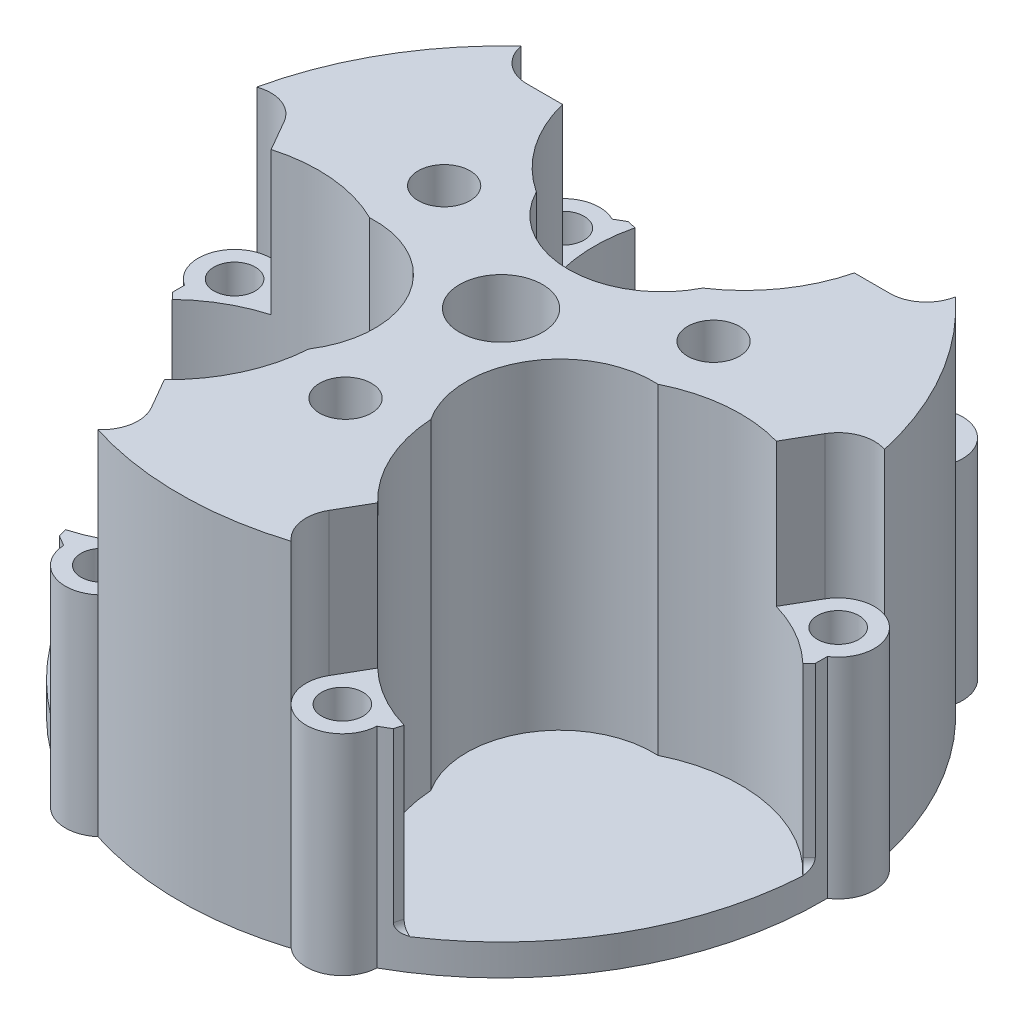
from build123d import *
from build123d.topology import SkipClean

# Parameters (mm, degrees)
BOSS_EXTRUDE1_DEPTH = 19
CUT_EXTRUDE1_START  = -1.8
SKETCH3_R           = 2
CUT_EXTRUDE1_DEPTH  = 1.8
BOSS_EXTRUDE2_START = 3
BOSS_EXTRUDE2_DEPTH = 3
SKETCH5_R           = 2
SKETCH5_R_2         = 4
SKETCH5_R_3         = 2.5
CUT_EXTRUDE2_DEPTH  = 51.078579515
CUT_EXTRUDE3_START  = -19
CUT_EXTRUDE3_DEPTH  = 19
SKETCH9_R           = 2.5
SKETCH9_R_2         = 4
BOSS_EXTRUDE3_DEPTH = 12
CUT_EXTRUDE4_START  = -31
CUT_EXTRUDE4_DEPTH  = 31
FILLET1_R           = 1


with BuildPart() as part:
    # Sketch1 → Boss-Extrude1 (new body)
    with BuildSketch(Plane(origin=(0, 0, 0), x_dir=(1, 0, 0), z_dir=(0, 1, 0))):
        with BuildLine():
            ThreePointArc((13.871296136, 27.723404255), (0, 9), (-13.871296136, 27.723404255))
            ThreePointArc((-13.871296136, 27.723404255), (-14.895543516, 27.186812674), (-15.899067131, 26.612396817))
            ThreePointArc((-15.899067131, 26.612396817), (-19.590431511, 26.307150886), (-20.940624191, 22.858045815))
            ThreePointArc((-20.940624191, 22.858045815), (-26.846787517, 15.5), (-30.265960452, 6.706089613))
            ThreePointArc((-30.265960452, 6.706089613), (-32.577876724, 3.812235917), (-30.996545265, 0.462797623))
            ThreePointArc((-30.996545265, 0.462797623), (-30.992242181, -0.693487249), (-30.944820433, -1.84880729))
            ThreePointArc((-30.944820433, -1.84880729), (-7.794228634, -4.5), (-17.073524296, -25.874596965))
            ThreePointArc((-17.073524296, -25.874596965), (-16.096698665, -26.493325425), (-15.097478134, -27.075194441))
            ThreePointArc((-15.097478134, -27.075194441), (-12.987445213, -30.119386803), (-9.325336261, -29.564135428))
            ThreePointArc((-9.325336261, -29.564135428), (0, -31), (9.325336261, -29.564135428))
            ThreePointArc((9.325336261, -29.564135428), (12.987445213, -30.119386803), (15.097478134, -27.075194441))
            ThreePointArc((15.097478134, -27.075194441), (16.096698665, -26.493325425), (17.073524296, -25.874596965))
            ThreePointArc((17.073524296, -25.874596965), (7.794228634, -4.5), (30.944820433, -1.84880729))
            ThreePointArc((30.944820433, -1.84880729), (30.992242181, -0.693487249), (30.996545265, 0.462797623))
            ThreePointArc((30.996545265, 0.462797623), (32.577876724, 3.812235917), (30.265960452, 6.706089613))
            ThreePointArc((30.265960452, 6.706089613), (26.846787517, 15.5), (20.940624191, 22.858045815))
            ThreePointArc((20.940624191, 22.858045815), (19.590431511, 26.307150886), (15.899067131, 26.612396817))
            ThreePointArc((15.899067131, 26.612396817), (14.895543516, 27.186812674), (13.871296136, 27.723404255))
        make_face()
    extrude(amount=BOSS_EXTRUDE1_DEPTH)

    # Sketch3 → Cut-Extrude1 (cut)
    # profile 1 of 6: a face of its own
    with BuildSketch(Plane(origin=(0, 19, 0), x_dir=(1, 0, 0), z_dir=(0, 1, 0)).offset(CUT_EXTRUDE1_START)):
        with BuildLine():
            ThreePointArc((-15.899067131, 26.612396817), (-20.901719334, 24.323593085), (-17.5, 20))
            Line((-17.5, 20), (-14.071247279, 20))
            ThreePointArc((-14.071247279, 20), (-14.495143202, 23.875264632), (-13.871296136, 27.723404255))
            ThreePointArc((-13.871296136, 27.723404255), (-14.895543516, 27.186812674), (-15.899067131, 26.612396817))
        make_face()
        with Locations(Location((-17.5, 23.5, 0), (0, 0, 270))):
            Circle(SKETCH3_R, mode=Mode.SUBTRACT)
    # profile 2 of 6: a face of its own
    with BuildSketch(Plane(origin=(0, 19, 0), x_dir=(1, 0, 0), z_dir=(0, 1, 0)).offset(CUT_EXTRUDE1_START)):
        with BuildLine():
            ThreePointArc((13.871296136, 27.723404255), (14.495143202, 23.875264632), (14.071247279, 20))
            Line((14.071247279, 20), (17.5, 20))
            ThreePointArc((17.5, 20), (20.901719334, 24.323593085), (15.899067131, 26.612396817))
            ThreePointArc((15.899067131, 26.612396817), (14.895543516, 27.186812674), (13.871296136, 27.723404255))
        make_face()
        with Locations(Location((17.5, 23.5, 0), (0, 0, 270))):
            Circle(SKETCH3_R, mode=Mode.SUBTRACT)
    # profile 3 of 6: a face of its own
    with BuildSketch(Plane(origin=(0, 19, 0), x_dir=(1, 0, 0), z_dir=(0, 1, 0)).offset(CUT_EXTRUDE1_START)):
        with BuildLine():
            ThreePointArc((-26.070508076, 5.155444566), (-31.51570919, 5.939623384), (-30.996545265, 0.462797623))
            ThreePointArc((-30.996545265, 0.462797623), (-30.992242181, -0.693487249), (-30.944820433, -1.84880729))
            ThreePointArc((-30.944820433, -1.84880729), (-27.924157295, 0.615529929), (-24.356131715, 2.186057607))
            Line((-24.356131715, 2.186057607), (-26.070508076, 5.155444566))
        make_face()
        with Locations(Location((-29.101596989, 3.405444566, 0), (0, 0, 270))):
            Circle(SKETCH3_R, mode=Mode.SUBTRACT)
    # profile 4 of 6: a face of its own
    with BuildSketch(Plane(origin=(0, 19, 0), x_dir=(1, 0, 0), z_dir=(0, 1, 0)).offset(CUT_EXTRUDE1_START)):
        with BuildLine():
            ThreePointArc((30.996545265, 0.462797623), (31.51570919, 5.939623384), (26.070508076, 5.155444566))
            Line((26.070508076, 5.155444566), (24.356131715, 2.186057607))
            ThreePointArc((24.356131715, 2.186057607), (27.924157295, 0.615529929), (30.944820433, -1.84880729))
            ThreePointArc((30.944820433, -1.84880729), (30.992242181, -0.693487249), (30.996545265, 0.462797623))
        make_face()
        with Locations(Location((29.101596989, 3.405444566, 0), (0, 0, 270))):
            Circle(SKETCH3_R, mode=Mode.SUBTRACT)
    # profile 5 of 6: a face of its own
    with BuildSketch(Plane(origin=(0, 19, 0), x_dir=(1, 0, 0), z_dir=(0, 1, 0)).offset(CUT_EXTRUDE1_START)):
        with BuildLine():
            Line((-8.570508076, -25.155444566), (-10.284884436, -22.186057607))
            ThreePointArc((-10.284884436, -22.186057607), (-13.429014092, -24.490794561), (-17.073524296, -25.874596965))
            ThreePointArc((-17.073524296, -25.874596965), (-16.096698665, -26.493325425), (-15.097478134, -27.075194441))
            ThreePointArc((-15.097478134, -27.075194441), (-10.613989856, -30.263216469), (-8.570508076, -25.155444566))
        make_face()
        with Locations(Location((-11.601596989, -26.905444566, 0), (0, 0, 270))):
            Circle(SKETCH3_R, mode=Mode.SUBTRACT)
    # profile 6 of 6: a face of its own
    with BuildSketch(Plane(origin=(0, 19, 0), x_dir=(1, 0, 0), z_dir=(0, 1, 0)).offset(CUT_EXTRUDE1_START)):
        with BuildLine():
            ThreePointArc((17.073524296, -25.874596965), (13.429014092, -24.490794561), (10.284884436, -22.186057607))
            Line((10.284884436, -22.186057607), (8.570508076, -25.155444566))
            ThreePointArc((8.570508076, -25.155444566), (10.613989856, -30.263216469), (15.097478134, -27.075194441))
            ThreePointArc((15.097478134, -27.075194441), (16.096698665, -26.493325425), (17.073524296, -25.874596965))
        make_face()
        with Locations(Location((11.601596989, -26.905444566, 0), (0, 0, 270))):
            Circle(SKETCH3_R, mode=Mode.SUBTRACT)
    extrude(amount=CUT_EXTRUDE1_DEPTH, mode=Mode.SUBTRACT)

    # Sketch8 → Boss-Extrude2 (add)
    with SkipClean():  # the faces are left unmerged after this step: merging them gives an invalid solid
        with BuildSketch(Plane.XZ.offset(BOSS_EXTRUDE2_START)):
            with BuildLine():
                ThreePointArc((-15.097478134, 27.075194441), (-26.846787517, 15.5), (-30.996545265, -0.462797623))
                ThreePointArc((-30.996545265, -0.462797623), (-32.577876724, -3.812235917), (-30.265960452, -6.706089613))
                ThreePointArc((-30.265960452, -6.706089613), (-26.846787517, -15.5), (-20.940624191, -22.858045815))
                ThreePointArc((-20.940624191, -22.858045815), (-19.590431511, -26.307150886), (-15.899067131, -26.612396817))
                ThreePointArc((-15.899067131, -26.612396817), (0, -31), (15.899067131, -26.612396817))
                ThreePointArc((15.899067131, -26.612396817), (19.590431511, -26.307150886), (20.940624191, -22.858045815))
                ThreePointArc((20.940624191, -22.858045815), (26.846787517, -15.5), (30.265960452, -6.706089613))
                ThreePointArc((30.265960452, -6.706089613), (32.577876724, -3.812235917), (30.996545265, -0.462797623))
                ThreePointArc((30.996545265, -0.462797623), (26.846787517, 15.5), (15.097478134, 27.075194441))
                ThreePointArc((15.097478134, 27.075194441), (12.987445213, 30.119386803), (9.325336261, 29.564135428))
                ThreePointArc((9.325336261, 29.564135428), (0, 31), (-9.325336261, 29.564135428))
                ThreePointArc((-9.325336261, 29.564135428), (-12.987445213, 30.119386803), (-15.097478134, 27.075194441))
            make_face()
        extrude(amount=-BOSS_EXTRUDE2_DEPTH)

    # Sketch5 → Cut-Extrude2 (cut, through all)
    with SkipClean():  # the faces are left unmerged after this step: merging them gives an invalid solid
        with BuildSketch(Plane(origin=(0, 19, 0), x_dir=(1, 0, 0), z_dir=(0, 1, 0))):
            with Locations(Location((17.5, 23.5, 0), (0, 0, 270))):
                Circle(SKETCH5_R)
            with Locations(Location((-17.5, 23.5, 0), (0, 0, 270))):
                Circle(SKETCH5_R)
            with Locations(Location((0, 0, 0), (0, 0, 270))):
                Circle(SKETCH5_R_2)
            with Locations(Location((-12.990381057, 7.5, 0), (0, 0, 270))):
                Circle(SKETCH5_R_3)
            with Locations(Location((12.990381057, 7.5, 0), (0, 0, 270))):
                Circle(SKETCH5_R_3)
            with Locations(Location((0, -15, 0), (0, 0, 270))):
                Circle(SKETCH5_R_3)
            with Locations(Location((-29.101596989, 3.405444566, 0), (0, 0, 270))):
                Circle(SKETCH5_R)
            with Locations(Location((11.601596989, -26.905444566, 0), (0, 0, 270))):
                Circle(SKETCH5_R)
            with Locations(Location((29.101596989, 3.405444566, 0), (0, 0, 270))):
                Circle(SKETCH5_R)
            with Locations(Location((-11.601596989, -26.905444566, 0), (0, 0, 270))):
                Circle(SKETCH5_R)
        extrude(amount=-CUT_EXTRUDE2_DEPTH, mode=Mode.SUBTRACT)

    # Sketch7 → Cut-Extrude3 (cut)
    with BuildSketch(Plane(origin=(0, 19, 0), x_dir=(1, 0, 0), z_dir=(0, 1, 0)).offset(CUT_EXTRUDE3_START)):
        with BuildLine():
            Line((-30.992242181, -0.693487249), (-30.406279294, -1.302351281))
            ThreePointArc((-30.406279294, -1.302351281), (-30.679164781, -1.572016727), (-30.944820433, -1.84880729))
            ThreePointArc((-30.944820433, -1.84880729), (-30.973918422, -1.271368391), (-30.992242181, -0.693487249))
        make_face()
        with BuildLine():
            ThreePointArc((-17.073524296, -25.874596965), (-16.700988811, -25.782927703), (-16.331008941, -25.681434662))
            Line((-16.331008941, -25.681434662), (-16.096698665, -26.493325425))
            ThreePointArc((-16.096698665, -26.493325425), (-16.587996535, -26.188516013), (-17.073524296, -25.874596965))
        make_face()
        with BuildLine():
            Line((16.096698665, -26.493325425), (16.331008941, -25.681434662))
            ThreePointArc((16.331008941, -25.681434662), (16.700988811, -25.782927703), (17.073524296, -25.874596965))
            ThreePointArc((17.073524296, -25.874596965), (16.587996535, -26.188516013), (16.096698665, -26.493325425))
        make_face()
        with BuildLine():
            ThreePointArc((30.944820433, -1.84880729), (30.679164781, -1.572016727), (30.406279294, -1.302351281))
            Line((30.406279294, -1.302351281), (30.992242181, -0.693487249))
            ThreePointArc((30.992242181, -0.693487249), (30.973918422, -1.271368391), (30.944820433, -1.84880729))
        make_face()
        with BuildLine():
            ThreePointArc((14.075270353, 26.983785943), (13.97817597, 27.35494443), (13.871296136, 27.723404255))
            ThreePointArc((13.871296136, 27.723404255), (14.385921887, 27.459884404), (14.895543516, 27.186812674))
            Line((14.895543516, 27.186812674), (14.075270353, 26.983785943))
        make_face()
        with BuildLine():
            ThreePointArc((-13.871296136, 27.723404255), (-13.97817597, 27.35494443), (-14.075270353, 26.983785943))
            Line((-14.075270353, 26.983785943), (-14.895543516, 27.186812674))
            ThreePointArc((-14.895543516, 27.186812674), (-14.385921887, 27.459884404), (-13.871296136, 27.723404255))
        make_face()
    extrude(amount=CUT_EXTRUDE3_DEPTH, mode=Mode.SUBTRACT)

    # Sketch9 → Boss-Extrude3 (add)
    with BuildSketch(Plane(origin=(0, 19, 0), x_dir=(1, 0, 0), z_dir=(0, 1, 0))):
        with BuildLine():
            ThreePointArc((-17.5, 20), (-19.736421288, 20.807711044), (-20.940624191, 22.858045815))
            ThreePointArc((-20.940624191, 22.858045815), (-26.846787517, 15.5), (-30.265960452, 6.706089613))
            ThreePointArc((-30.265960452, 6.706089613), (-27.888217002, 6.688386693), (-26.070508076, 5.155444566))
            Line((-26.070508076, 5.155444566), (-24.356131715, 2.186057607))
            ThreePointArc((-24.356131715, 2.186057607), (-7.794228634, -4.5), (-10.284884436, -22.186057607))
            Line((-10.284884436, -22.186057607), (-8.570508076, -25.155444566))
            ThreePointArc((-8.570508076, -25.155444566), (-8.151795715, -27.496097737), (-9.325336261, -29.564135428))
            ThreePointArc((-9.325336261, -29.564135428), (0, -31), (9.325336261, -29.564135428))
            ThreePointArc((9.325336261, -29.564135428), (8.151795715, -27.496097737), (8.570508076, -25.155444566))
            Line((8.570508076, -25.155444566), (10.284884436, -22.186057607))
            ThreePointArc((10.284884436, -22.186057607), (7.794228634, -4.5), (24.356131715, 2.186057607))
            Line((24.356131715, 2.186057607), (26.070508076, 5.155444566))
            ThreePointArc((26.070508076, 5.155444566), (27.888217002, 6.688386693), (30.265960452, 6.706089613))
            ThreePointArc((30.265960452, 6.706089613), (26.846787517, 15.5), (20.940624191, 22.858045815))
            ThreePointArc((20.940624191, 22.858045815), (19.736421288, 20.807711044), (17.5, 20))
            Line((17.5, 20), (14.071247279, 20))
            ThreePointArc((14.071247279, 20), (0, 9), (-14.071247279, 20))
            Line((-14.071247279, 20), (-17.5, 20))
        make_face()
        with Locations(Location((0, -15, 0), (0, 0, 270))):
            Circle(SKETCH9_R, mode=Mode.SUBTRACT)
        with Locations(Location((-12.990381057, 7.5, 0), (0, 0, 270))):
            Circle(SKETCH9_R, mode=Mode.SUBTRACT)
        with Locations(Location((12.990381057, 7.5, 0), (0, 0, 270))):
            Circle(SKETCH9_R, mode=Mode.SUBTRACT)
        with Locations(Location((0, 0, 0), (0, 0, 270))):
            Circle(SKETCH9_R_2, mode=Mode.SUBTRACT)
    extrude(amount=BOSS_EXTRUDE3_DEPTH)

    # Sketch14 → Cut-Extrude4 (cut)
    with BuildSketch(Plane(origin=(0, 31, 0), x_dir=(1, 0, 0), z_dir=(0, 1, 0)).offset(CUT_EXTRUDE4_START)):
        with BuildLine():
            ThreePointArc((-8.023022902, 11.421875), (0, 6.5), (8.023022902, 11.421875))
            ThreePointArc((8.023022902, 11.421875), (0, 9), (-8.023022902, 11.421875))
        make_face()
        with BuildLine():
            ThreePointArc((13.90314536, 1.237204148), (7.794228634, -4.5), (5.880122458, -12.659079148))
            ThreePointArc((5.880122458, -12.659079148), (5.629165125, -3.25), (13.90314536, 1.237204148))
        make_face()
        with BuildLine():
            ThreePointArc((-5.880122458, -12.659079148), (-7.794228634, -4.5), (-13.90314536, 1.237204148))
            ThreePointArc((-13.90314536, 1.237204148), (-5.629165125, -3.25), (-5.880122458, -12.659079148))
        make_face()
    extrude(amount=CUT_EXTRUDE4_DEPTH, mode=Mode.SUBTRACT)

    # Fillet1
    # the kernel refuses this fillet: 1 mm, written as the material it adds along each edge
    with BuildSketch(Plane(origin=(-32.725808096, 0, -1.107831496), x_dir=(-0.7205274978491865, 0, 0.6934263658408084), z_dir=(0.6934263658408084, 0, 0.7205274978491865))) as fillet1_piece_1_section:
        with BuildLine():
            CenterArc((FILLET1_R, -FILLET1_R), FILLET1_R, 90, 90)
            Line((0, -FILLET1_R), (0, 0))
            Line((0, 0), (FILLET1_R, 0))
        make_face()
    fillet1_piece_1 = extrude(amount=5.845025394, mode=Mode.PRIVATE)
    fillet1_piece_1 = fillet1_piece_1 & Plane(origin=(0, 0.275496512, 0), x_dir=(-0.48701542367600353, 0, 0.8733933690506717), z_dir=(0, -1, 0)) * Cylinder(31, 16, mode=Mode.PRIVATE)
    fillet1_piece_1 = fillet1_piece_1 - Plane(origin=(-20.351596989, 0.275496512, 11.75), x_dir=(-0.7305671340428671, 0, -0.6828408765271684), z_dir=(0, -1, 0)) * Cylinder(14.5, 16, mode=Mode.PRIVATE)
    add(fillet1_piece_1)
    with BuildSketch(Plane(origin=(-11.648499602, 0, -26.383133195), x_dir=(0.24026109954733937, 0, -0.9707083001830692), z_dir=(-0.9707083001830692, 0, -0.24026109954733937))) as fillet1_piece_2_section:
        with BuildLine():
            CenterArc((FILLET1_R, -FILLET1_R), FILLET1_R, 90, 90)
            Line((0, -FILLET1_R), (0, 0))
            Line((0, 0), (FILLET1_R, 0))
        make_face()
    fillet1_piece_2 = extrude(amount=5.845025394, mode=Mode.PRIVATE)
    fillet1_piece_2 = fillet1_piece_2 & Plane(origin=(0, 0.275496589, 0), x_dir=(-0.5128731332567569, 0, -0.8584644134635966), z_dir=(0, -1, 0)) * Cylinder(31, 16, mode=Mode.PRIVATE)
    fillet1_piece_2 = fillet1_piece_2 - Plane(origin=(0, 0.275496589, -23.5), x_dir=(0.9566411128363953, 0, -0.29126925898752726), z_dir=(0, -1, 0)) * Cylinder(14.5, 16, mode=Mode.PRIVATE)
    add(fillet1_piece_2)
    with BuildSketch(Plane(origin=(17.322314267, 0, -27.787465423), x_dir=(-0.2402610995474686, 0, -0.9707083001830373), z_dir=(-0.9707083001830372, 0, 0.24026109954746858))) as fillet1_piece_3_section:
        with BuildLine():
            CenterArc((FILLET1_R, -FILLET1_R), FILLET1_R, 90, 90)
            Line((0, -FILLET1_R), (0, 0))
            Line((0, 0), (FILLET1_R, 0))
        make_face()
    fillet1_piece_3 = extrude(amount=5.845025394, mode=Mode.PRIVATE)
    fillet1_piece_3 = fillet1_piece_3 & Plane(origin=(0, 0.275496512, 0), x_dir=(-0.5128731332567569, 0, -0.8584644134635966), z_dir=(0, -1, 0)) * Cylinder(31, 16, mode=Mode.PRIVATE)
    fillet1_piece_3 = fillet1_piece_3 - Plane(origin=(0, 0.275496512, -23.5), x_dir=(0.9566411128363953, 0, -0.29126925898752726), z_dir=(0, -1, 0)) * Cylinder(14.5, 16, mode=Mode.PRIVATE)
    add(fillet1_piece_3)
    with BuildSketch(Plane(origin=(28.672713379, 0, 3.103670026), x_dir=(0.7205274978492641, 0, 0.6934263658407279), z_dir=(0.6934263658407279, 0, -0.7205274978492641))) as fillet1_piece_4_section:
        with BuildLine():
            CenterArc((FILLET1_R, -FILLET1_R), FILLET1_R, 90, 90)
            Line((0, -FILLET1_R), (0, 0))
            Line((0, 0), (FILLET1_R, 0))
        make_face()
    fillet1_piece_4 = extrude(amount=5.845025394, mode=Mode.PRIVATE)
    fillet1_piece_4 = fillet1_piece_4 & Plane(origin=(0, 0.275496589, 0), x_dir=(0.9998885569327609, 0, -0.014928955587075495), z_dir=(0, -1, 0)) * Cylinder(31, 16, mode=Mode.PRIVATE)
    fillet1_piece_4 = fillet1_piece_4 - Plane(origin=(20.351596989, 0.275496589, 11.75), x_dir=(-0.22607397879350336, 0, 0.9741101355147038), z_dir=(0, -1, 0)) * Cylinder(14.5, 16, mode=Mode.PRIVATE)
    add(fillet1_piece_4)
    with BuildSketch(Plane(origin=(15.403493829, 0, 28.895296919), x_dir=(0.9607885973966587, 0, 0.2772819343422169), z_dir=(0.27728193434221693, 0, -0.9607885973966587))) as fillet1_piece_5_section:
        with BuildLine():
            CenterArc((FILLET1_R, -FILLET1_R), FILLET1_R, 90, 90)
            Line((0, -FILLET1_R), (0, 0))
            Line((0, 0), (FILLET1_R, 0))
        make_face()
    fillet1_piece_5 = extrude(amount=5.845025394, mode=Mode.PRIVATE)
    fillet1_piece_5 = fillet1_piece_5 & Plane(origin=(0, 0.275496512, 0), x_dir=(0.9998885569327609, 0, -0.014928955587075495), z_dir=(0, -1, 0)) * Cylinder(31, 16, mode=Mode.PRIVATE)
    fillet1_piece_5 = fillet1_piece_5 - Plane(origin=(20.351596989, 0.275496512, 11.75), x_dir=(-0.22607397879350336, 0, 0.9741101355147038), z_dir=(0, -1, 0)) * Cylinder(14.5, 16, mode=Mode.PRIVATE)
    add(fillet1_piece_5)
    with BuildSketch(Plane(origin=(-17.024213777, 0, 23.279463169), x_dir=(-0.9607885973966223, 0, 0.2772819343423431), z_dir=(0.2772819343423431, 0, 0.9607885973966221))) as fillet1_piece_6_section:
        with BuildLine():
            CenterArc((FILLET1_R, -FILLET1_R), FILLET1_R, 90, 90)
            Line((0, -FILLET1_R), (0, 0))
            Line((0, 0), (FILLET1_R, 0))
        make_face()
    fillet1_piece_6 = extrude(amount=5.845025394, mode=Mode.PRIVATE)
    fillet1_piece_6 = fillet1_piece_6 & Plane(origin=(0, 0.275496589, 0), x_dir=(-0.48701542367600353, 0, 0.8733933690506717), z_dir=(0, -1, 0)) * Cylinder(31, 16, mode=Mode.PRIVATE)
    fillet1_piece_6 = fillet1_piece_6 - Plane(origin=(-20.351596989, 0.275496589, 11.75), x_dir=(-0.7305671340428671, 0, -0.6828408765271684), z_dir=(0, -1, 0)) * Cylinder(14.5, 16, mode=Mode.PRIVATE)
    add(fillet1_piece_6)


solid = part.part
